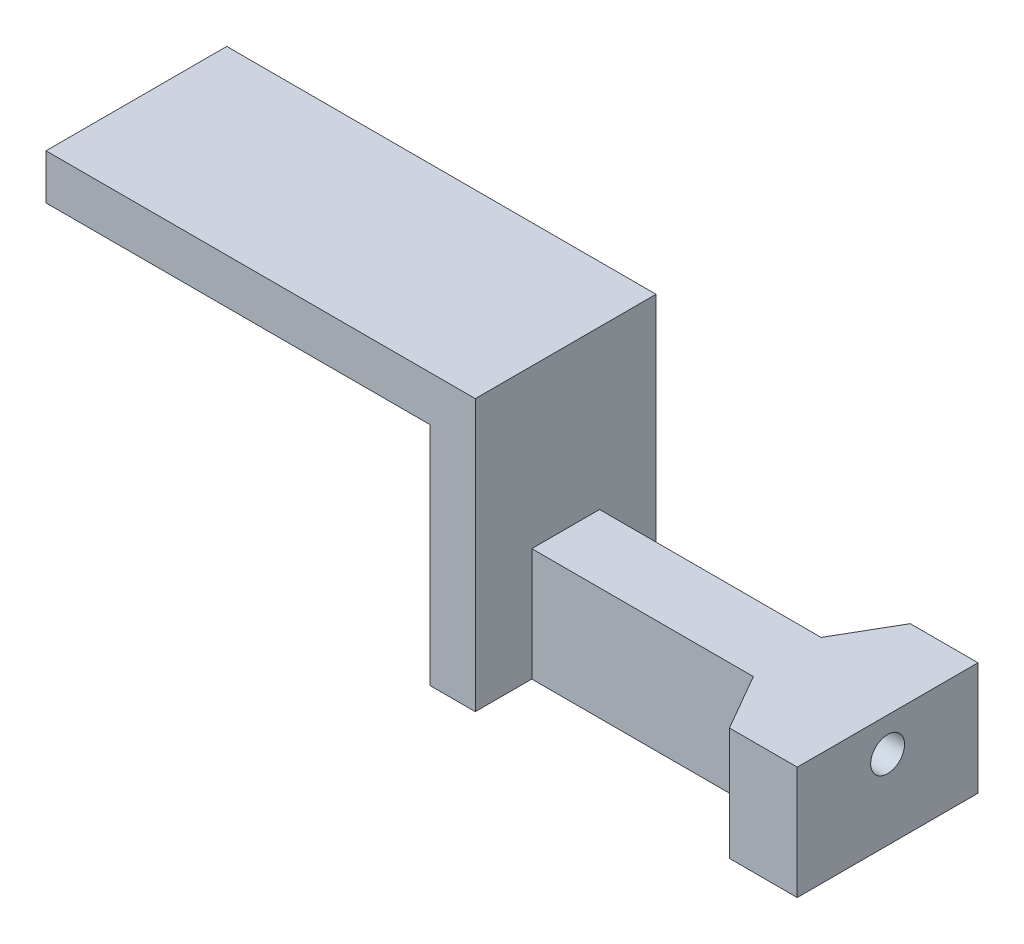
from build123d import *

# Parameters (mm, degrees)
SKETCH1_W               = 21
SKETCH1_H               = 9
BOSS_EXTRUDE1_DEPTH     = 4
CUT_EXTRUDE1_REACH      = 15.946
SKETCH2_W               = 17
SKETCH2_H               = 7
CUT_EXTRUDE3_REACH      = 15.946
SKETCH5_W               = 2
SKETCH5_H               = 9
BOSS_EXTRUDE2_REACH     = 21.931
SKETCH9_W               = 2
SKETCH9_H               = 3
BOSS_EXTRUDE3_DEPTH     = 8
SKETCH11_W              = 3
SKETCH11_H              = 5
BOSS_EXTRUDE4_DEPTH     = 11.25
BOSS_EXTRUDE5_START     = -4
BOSS_EXTRUDE5_OUTLINE_W = 3
BOSS_EXTRUDE5_OUTLINE_H = 5
BOSS_EXTRUDE5_DEPTH     = 8
SKETCH13_R              = 0.75
CUT_EXTRUDE4_DEPTH      = 2.5
BOSS_EXTRUDE6_DEPTH     = 5
BOSS_EXTRUDE7_REACH     = 29.795


# Read off the part's stored shape, not the designer's step: Boss-Extrude5
with BuildPart() as part:
    # Sketch1 → Boss-Extrude1 (new, symmetric)
    with BuildSketch(Plane.XY):
        Rectangle(SKETCH1_W, SKETCH1_H)
    extrude(amount=BOSS_EXTRUDE1_DEPTH, both=True)

    # Sketch2 → Cut-Extrude1 (cut, up to next)
    with BuildSketch(Plane.XY.offset(4), mode=Mode.PRIVATE) as cut_extrude1_sk1:
        with Locations((0, -1)):
            Rectangle(SKETCH2_W, SKETCH2_H)
    cut_extrude1_tool1 = extrude(cut_extrude1_sk1.sketch, amount=-CUT_EXTRUDE1_REACH, mode=Mode.PRIVATE) & part.part
    add(cut_extrude1_tool1.solids().sort_by_distance((0, -1, 4))[0], mode=Mode.SUBTRACT)

    # Sketch5 → Cut-Extrude3 (cut, up to next)
    with BuildSketch(Plane.XY.offset(4), mode=Mode.PRIVATE) as cut_extrude3_sk1:
        with Locations((-9.5, 0)):
            Rectangle(SKETCH5_W, SKETCH5_H)
    cut_extrude3_tool1 = extrude(cut_extrude3_sk1.sketch, amount=-CUT_EXTRUDE3_REACH, mode=Mode.PRIVATE) & part.part
    add(cut_extrude3_tool1.solids().sort_by_distance((-9.5, 0, 4))[0], mode=Mode.SUBTRACT)

    # Sketch7 → Boss-Extrude2 (add, up to next)
    with BuildSketch(Plane.ZY.offset(8.5), mode=Mode.PRIVATE) as boss_extrude2_sk1:
        Polygon((1, 2.5), (-1, 2.5), (-1.75, 1), (1.75, 1), align=None)
    boss_extrude2_tool1 = extrude(boss_extrude2_sk1.sketch, amount=-BOSS_EXTRUDE2_REACH, mode=Mode.PRIVATE) - part.part
    add(boss_extrude2_tool1.solids().sort_by_distance((-8.5, 1.681818, 0))[0])

    # Sketch9 → Boss-Extrude3 (add)
    with BuildSketch(Plane.XY.offset(4)):
        with Locations((9.5, -6)):
            Rectangle(SKETCH9_W, SKETCH9_H)
    extrude(amount=-BOSS_EXTRUDE3_DEPTH)

    # Sketch11 → Boss-Extrude4 (add)
    with BuildSketch(Plane(origin=(10.5, 0, 0), x_dir=(0, 0, -1), z_dir=(1, 0, 0))):
        with Locations((0, -5)):
            Rectangle(SKETCH11_W, SKETCH11_H)
    extrude(amount=BOSS_EXTRUDE4_DEPTH)

    # Boss-Extrude5 outline → Boss-Extrude5 (add)
    with BuildSketch(Plane.XY.offset(BOSS_EXTRUDE5_START)):
        with Locations((23.25, -5)):
            Rectangle(BOSS_EXTRUDE5_OUTLINE_W, BOSS_EXTRUDE5_OUTLINE_H)
    extrude(amount=BOSS_EXTRUDE5_DEPTH)

    # Sketch13 → Cut-Extrude4 (cut)
    with BuildSketch(Plane(origin=(24.75, 0, 0), x_dir=(0, 0, -1), z_dir=(1, 0, 0))):
        with Locations((0, -4)):
            Circle(SKETCH13_R)
    extrude(amount=-CUT_EXTRUDE4_DEPTH, mode=Mode.SUBTRACT)

    # Sketch14 → Boss-Extrude6 (add)
    with BuildSketch(Plane.XZ.offset(7.5)):
        Polygon((21.75, 4), (20.306624327, 1.5), (21.75, 1.5), align=None)
        Polygon((21.75, -4), (21.75, -1.5), (20.306624327, -1.5), align=None)
    extrude(amount=-BOSS_EXTRUDE6_DEPTH)

    # Boss-Extrude7: up to this face of the body (flat: up to its plane)
    boss_extrude7_end = Plane(part.part.faces().sort_by_distance((1, 4.5, 0))[0])
    # Sketch15 → Boss-Extrude7 (add, up to the picked face)
    with BuildSketch(Plane.XZ.offset(7.5), mode=Mode.PRIVATE) as boss_extrude7_sk1:
        Polygon((8.5, 4), (8.5, -4), (6.190598923, 0), align=None)
    boss_extrude7_tool1 = split(extrude(boss_extrude7_sk1.sketch, amount=-BOSS_EXTRUDE7_REACH, mode=Mode.PRIVATE), bisect_by=boss_extrude7_end, keep=Keep.BOTH, mode=Mode.PRIVATE)
    add(boss_extrude7_tool1.solids().sort_by(Axis((7.7302, -7.5, 0), (0, 1, 0)))[0])


solid = part.part
